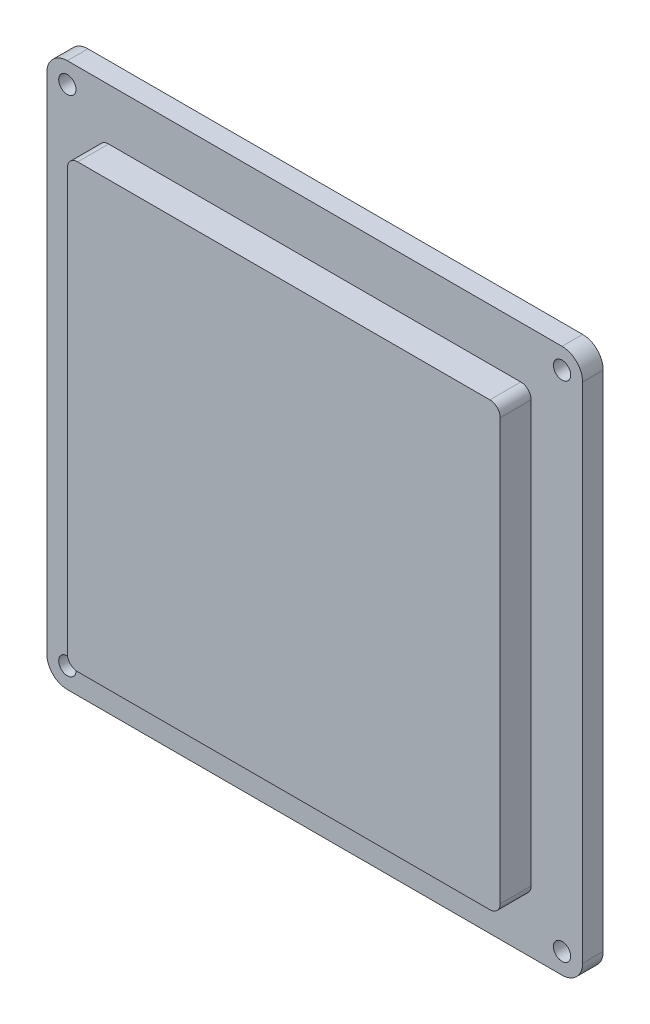
from build123d import *

# Parameters (mm, degrees)
SKETCH_1_W              = 260
SKETCH_1_H              = 264.25
EXTRUDE_1_DEPTH         = 10
FILLET_1_R              = 10
HOLE_WIZARD_8_4_8_4_1_D = 8.4
SKETCH_4_W              = 210
SKETCH_4_H              = 214.25
EXTRUDE_2_DEPTH         = 15
FILLET_2_R              = 5


with BuildPart() as part:
    # 草图1 → 凸台-拉伸1 (new body)
    with BuildSketch(Plane.XY):
        Rectangle(SKETCH_1_W, SKETCH_1_H)
    extrude(amount=EXTRUDE_1_DEPTH)

    # 圆角1
    fillet_1_edges = [part.edges().sort_by_distance(p)[0] for p in [
        (130, -132.125, 5),
        (-130, -132.125, 5),
        (-130, 132.125, 5),
        (130, 132.125, 5),
    ]]
    fillet(fillet_1_edges, radius=FILLET_1_R)

    # Ø8.4 (8.4) 直径孔1 (through all)
    with Locations(Plane(origin=(0, 0, 0), x_dir=(1, 0, 0), z_dir=(0, 0, -1))):
        with Locations((-120, -122.125), (120, -122.125), (120, 122.125), (-120, 122.125)):
            Hole(HOLE_WIZARD_8_4_8_4_1_D / 2)

    # 草图4 → 凸台-拉伸2 (add)
    with BuildSketch(Plane.XY.offset(10)):
        Rectangle(SKETCH_4_W, SKETCH_4_H)
    extrude(amount=EXTRUDE_2_DEPTH)

    # 圆角2
    fillet_2_edges = [part.edges().sort_by_distance(p)[0] for p in [
        (-105, -107.125, 17.5),
        (-105, 107.125, 17.5),
        (105, 107.125, 17.5),
        (105, -107.125, 17.5),
    ]]
    fillet(fillet_2_edges, radius=FILLET_2_R)


solid = part.part
